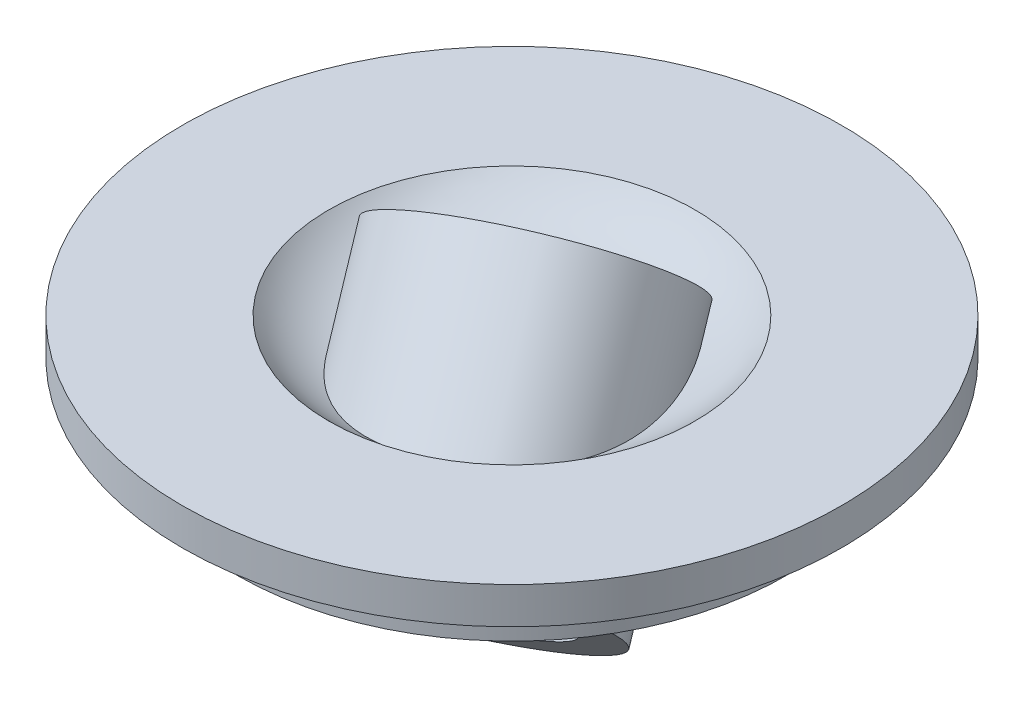
from build123d import *

# Parameters (mm, degrees)
SKETCH1_R           = 7.5
BOSS_EXTRUDE2_DEPTH = 1.4
SKETCH3_R           = 9
SKETCH3_R_2         = 5
BOSS_EXTRUDE3_DEPTH = 1
FILLET1_R           = 3
SKETCH4_R           = 3.5
SKETCH4_R_2         = 2.5
BOSS_EXTRUDE5_DEPTH = 7
SKETCH5_R           = 2.5
CUT_EXTRUDE1_DEPTH  = 64.560554084


with BuildPart() as part:
    # Sketch1 → Boss-Extrude2 (new body)
    with BuildSketch(Plane(origin=(0, 2.1, 0), x_dir=(1, 0, 0), z_dir=(0, 1, 0))):
        with Locations(Location((-40.5, -30.5, 0), (0, 0, 270))):
            Circle(SKETCH1_R)
    extrude(amount=-BOSS_EXTRUDE2_DEPTH)

    # Sketch3 → Boss-Extrude3 (add)
    with BuildSketch(Plane(origin=(0, 2.1, 0), x_dir=(1, 0, 0), z_dir=(0, 1, 0))):
        with Locations(Location((-40.5, -30.5, 0), (0, 0, 270))):
            Circle(SKETCH3_R)
        with Locations(Location((-40.5, -30.5, 0), (0, 0, 270))):
            Circle(SKETCH3_R_2, mode=Mode.SUBTRACT)
    extrude(amount=BOSS_EXTRUDE3_DEPTH)

    # Fillet1
    # the kernel refuses this fillet: 3 mm, written as the material it adds along each edge
    with BuildSketch(Plane(origin=(-40.5, 2.1, 30.5), x_dir=(0, 0, 1), z_dir=(-1, 0, 0))) as fillet1_piece_1:
        with BuildLine():
            CenterArc((2.763932023, 3), FILLET1_R, 270, 48.189685104)
            Line((2.763932023, 0), (2.763932023, -0.06))
            Line((2.763932023, -0.06), (5, -0.06))
            Line((5, -0.06), (5.06, 0))
            ThreePointArc((5.06, 0), (5.06, 0.5), (5.04472136, 0.96))
            Line((5.04472136, 0.96), (5, 1))
        make_face()
    revolve(axis=Axis((-40.5, 2.1, 30.5), (0, 1, 0)))

    # Sketch4 → Boss-Extrude5 (add)
    with BuildSketch(Plane(origin=(-38.945196608, -1.435533906, 33.675308869), x_dir=(0.9504227777675709, 0.2313522039987804, -0.20778041583720402), z_dir=(-0.3109606783832559, 0.7071067811865516, -0.6350617737664737))):
        Circle(SKETCH4_R)
        with Locations(Location((0, 0, 0), (0, 0, 70.528842864))):
            Circle(SKETCH4_R_2, mode=Mode.SUBTRACT)
    extrude(amount=BOSS_EXTRUDE5_DEPTH)

    # Sketch5 → Cut-Extrude1 (cut, through all)
    with BuildSketch(Plane(origin=(3.199957151, -7.276519373, 6.535136451), x_dir=(0.9504227777675709, 0.2313522039987803, -0.20778041583720397), z_dir=(0.3109606783832558, -0.7071067811865516, 0.6350617737664735))):
        with Locations(Location((-44.343585554, 24.094947098, 0), (0, 0, 289.471157136))):
            Circle(SKETCH5_R)
    extrude(amount=-CUT_EXTRUDE1_DEPTH, mode=Mode.SUBTRACT)


solid = part.part
